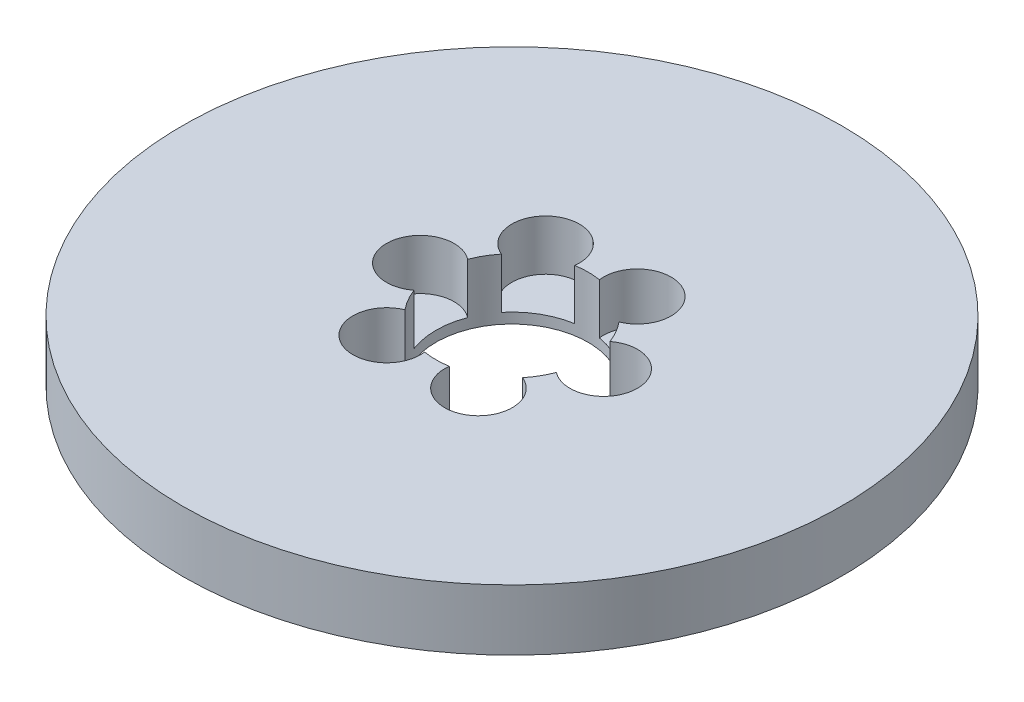
from build123d import *

# Parameters (mm, degrees)
SKETCH1_R           = 97.5
BOSS_EXTRUDE1_DEPTH = 18
SKETCH2_R           = 22.5
CUT_EXTRUDE1_DEPTH  = 140.055744218
SKETCH3_R           = 10
CUT_EXTRUDE2_DEPTH  = 14.928686613
CIRPATTERN1_COUNT   = 6


with BuildPart() as part:
    # Sketch1 → Boss-Extrude1 (new body)
    with BuildSketch(Plane(origin=(0, 0, 0), x_dir=(1, 0, 0), z_dir=(0, 1, 0))):
        Circle(SKETCH1_R)
    extrude(amount=BOSS_EXTRUDE1_DEPTH)

    # Sketch2 → Cut-Extrude1 (cut, through all)
    with BuildSketch(Plane(origin=(0, 0, 0), x_dir=(1, 0, 0), z_dir=(0, 1, 0))):
        Circle(SKETCH2_R)
    extrude(amount=CUT_EXTRUDE1_DEPTH, mode=Mode.SUBTRACT)

    # Sketch3 → Cut-Extrude2 (cut)
    with BuildSketch(Plane(origin=(0, 18, 0), x_dir=(1, 0, 0), z_dir=(0, 1, 0))):
        with Locations((-27.131078865, 0)):
            Circle(SKETCH3_R)
    cut_extrude2 = extrude(amount=-CUT_EXTRUDE2_DEPTH, mode=Mode.SUBTRACT)

    # CirPattern1: Cut-Extrude2 ×6 about axis
    cirpattern1_axis = Axis((0, 0, 0), (0, 1, 0))
    for i in range(1, CIRPATTERN1_COUNT):
        add(cut_extrude2.rotate(cirpattern1_axis, i * 360 / CIRPATTERN1_COUNT), mode=Mode.SUBTRACT)


solid = part.part
